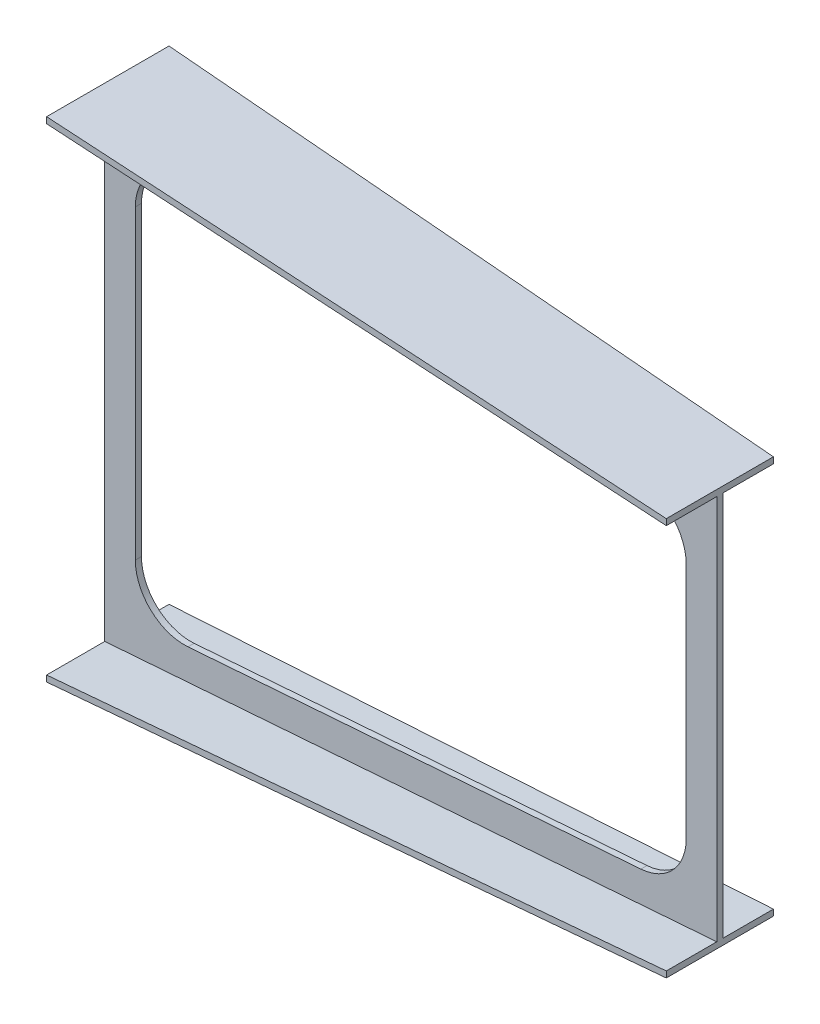
from build123d import *

# Parameters (mm, degrees)
CUT_EXTRUDE1_DEPTH = 1083.13908547


with BuildPart() as part:
    # Sketch1 → Loft l1 section 0
    with BuildSketch(Plane(origin=(0, 0, 0), x_dir=(0, 0, -1), z_dir=(1, 0, 0))):
        with BuildLine():
            Line((-105, 400), (95, 400))
            Line((95, 400), (95, 390))
            Line((95, 390), (0, 390))
            Line((0, 390), (0, -390))
            Line((0, -390), (95, -390))
            Line((95, -390), (95, -400))
            Line((95, -400), (-105, -400))
            Line((-105, -400), (-105, -390))
            Line((-105, -390), (-10, -390))
            Line((-10, -390), (-10, 390))
            Line((-10, 390), (-105, 390))
            Line((-105, 390), (-105, 400))
        make_face()
    # Sketch4 → Loft l1 section 1
    with BuildSketch(Plane(origin=(1000, 0, -1000), x_dir=(0, 0, 1), z_dir=(-1, 0, 0))):
        with BuildLine():
            Line((917.5, 325), (1092.5, 325))
            Line((1092.5, 325), (1092.5, 315))
            Line((1092.5, 315), (1010, 315))
            Line((1010, 315), (1010, -315))
            Line((1010, -315), (1092.5, -315))
            Line((1092.5, -315), (1092.5, -325))
            Line((1092.5, -325), (917.5, -325))
            Line((917.5, -325), (917.5, -315))
            Line((917.5, -315), (1000, -315))
            Line((1000, -315), (1000, 315))
            Line((1000, 315), (917.5, 315))
            Line((917.5, 315), (917.5, 325))
        make_face()
    loft()

    # Sketch6 → Cut-Extrude1 (cut, through all)
    with BuildSketch(Plane.XY.offset(10)):
        with BuildLine():
            Line((135.983195859, -329.66083251), (875.983195859, -274.16083251))
            ThreePointArc((875.983195859, -274.16083251), (928.64578275, -248.796946728), (950, -194.384887719))
            Line((950, -194.384887719), (950, 194.384887719))
            ThreePointArc((950, 194.384887719), (928.64578275, 248.796946728), (875.983195859, 274.16083251))
            Line((875.983195859, 274.16083251), (135.983195859, 329.66083251))
            ThreePointArc((135.983195859, 329.66083251), (75.587940991, 308.530670469), (50, 249.884887719))
            Line((50, 249.884887719), (50, -249.884887719))
            ThreePointArc((50, -249.884887719), (75.587940991, -308.530670469), (135.983195859, -329.66083251))
        make_face()
    extrude(amount=-CUT_EXTRUDE1_DEPTH, mode=Mode.SUBTRACT)


solid = part.part
